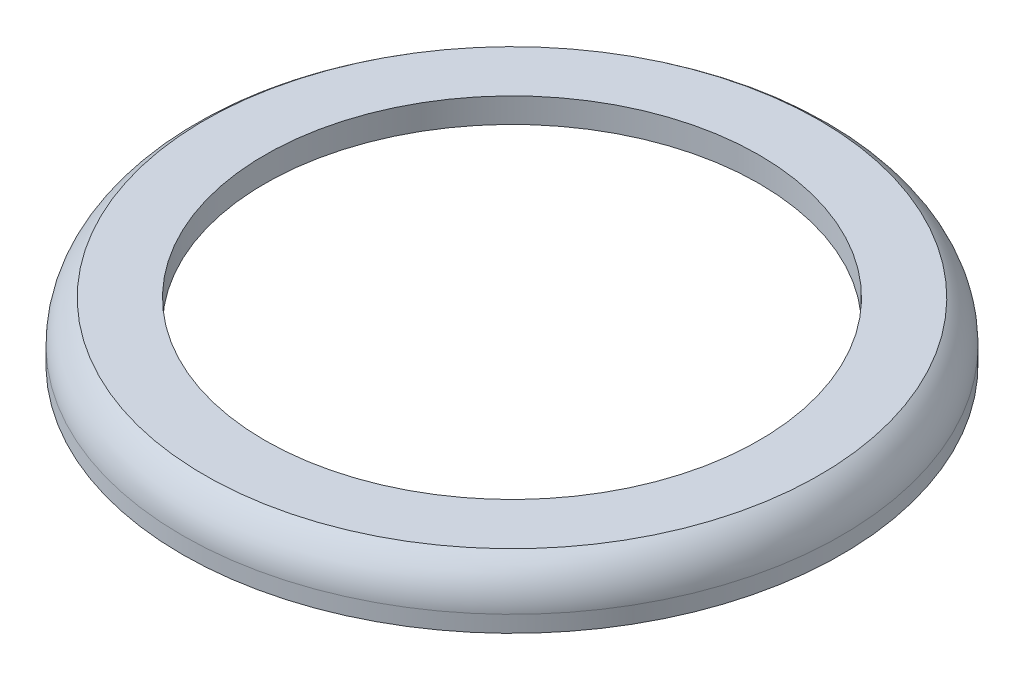
from build123d import *

# Parameters (mm, degrees)
REDONDEO1_R = 0.25


with BuildPart() as part:
    # Croquis1 → Revolución1 (revolve)
    with BuildSketch(Plane.XY, mode=Mode.PRIVATE) as revoluci_n1_sk:
        with BuildLine():
            Line((20, 0), (20, 1))
            ThreePointArc((20, 1), (19.643382037, 2.418637165), (18.658312395, 3.5))
            Line((18.658312395, 3.5), (15, 3.5))
            Line((15, 3.5), (15, 2))
            Line((15, 2), (19, 2))
            Line((19, 2), (19, 1))
            Line((19, 1), (18.5, 1))
            Line((18.5, 1), (18.5, 0))
            Line((18.5, 0), (20, 0))
        make_face()
    revolve(revoluci_n1_sk.sketch.rotate(Axis((0, 0, 0), (0, 1, 0)), 90), axis=Axis((0, 0, 0), (0, 1, 0)))

    # Redondeo1
    redondeo1_edges = [part.edges().sort_by_distance(p)[0] for p in [
        (0, 0, 18.5),
        (0, 1, 18.5),
        (0, 1, 19),
        (0, 2, 19),
    ]]
    fillet(redondeo1_edges, radius=REDONDEO1_R - 0.0001)  # a hair under: the kernel refuses the full size


solid = part.part
